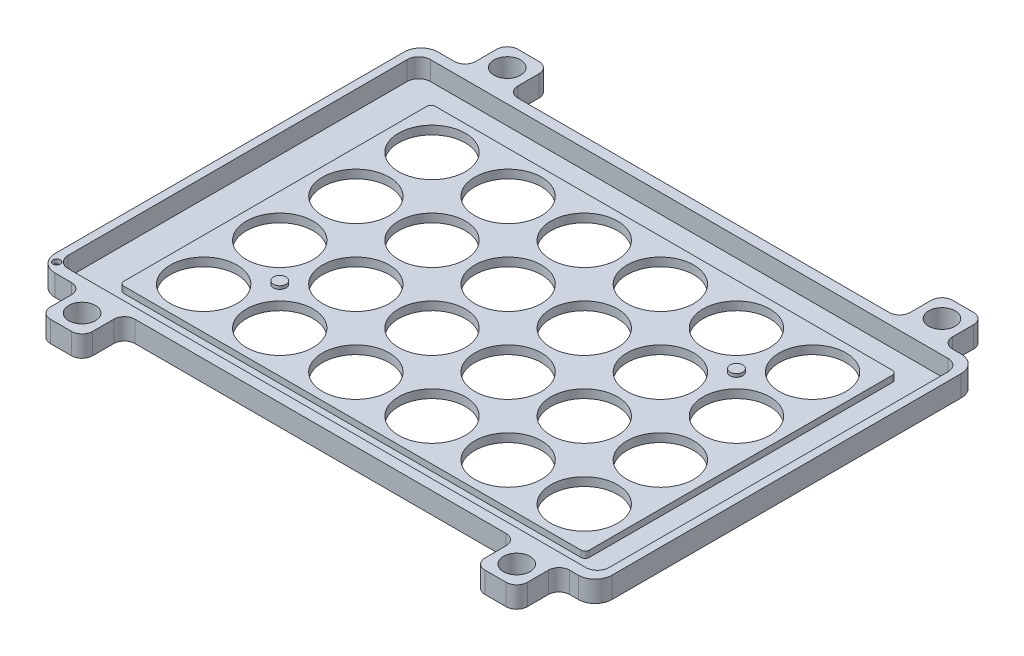
from build123d import *

# Parameters (mm, degrees)
SKETCH1_W           = 157.0786
SKETCH1_H           = 90.551
BOSS_EXTRUDE1_DEPTH = 5
SKETCH7_R           = 7.895
CUT_EXTRUDE5_DEPTH  = 182.378527337
SKETCH23_W          = 127.9
SKETCH23_H          = 85.66
SKETCH23_W_2        = 110.1
SKETCH23_H_2        = 73.66
CUT_EXTRUDE21_DEPTH = 4.5
FILLET7_R           = 1
FILLET8_R           = 2.75
SKETCH26_W          = 115.5003573
SKETCH26_H          = 73.66
CUT_EXTRUDE22_DEPTH = 3
SKETCH29_W          = 12.67569
SKETCH29_H          = 90.551
CUT_EXTRUDE25_DEPTH = 182.378527337
FILLET9_R           = 4
SKETCH30_W          = 10
SKETCH30_H          = 10
BOSS_EXTRUDE2_DEPTH = 5
SKETCH31_R          = 3.15
CUT_EXTRUDE26_DEPTH = 177.033246909
FILLET10_R          = 2.5
SKETCH35_R          = 1.5
BOSS_EXTRUDE3_DEPTH = 0.75
SKETCH37_R          = 0.875
CUT_EXTRUDE29_DEPTH = 1


with BuildPart() as part:
    # Sketch1 → Boss-Extrude1 (new body)
    with BuildSketch(Plane(origin=(0, 0, 0), x_dir=(1, 0, 0), z_dir=(0, 1, 0))):
        with Locations((78.5393, -45.2755)):
            Rectangle(SKETCH1_W, SKETCH1_H)
    extrude(amount=BOSS_EXTRUDE1_DEPTH)

    # Sketch7 → Cut-Extrude5 (cut, through all)
    with BuildSketch(Plane.XZ):
        with Locations((33.5393, 72.2755)):
            Circle(SKETCH7_R)
        with Locations((51.5393, 72.2755)):
            Circle(SKETCH7_R)
        with Locations((69.5393, 72.2755)):
            Circle(SKETCH7_R)
        with Locations((87.5393, 72.2755)):
            Circle(SKETCH7_R)
        with Locations((105.5393, 72.2755)):
            Circle(SKETCH7_R)
        with Locations((123.5393, 72.2755)):
            Circle(SKETCH7_R)
        with Locations((51.5393, 54.2755)):
            Circle(SKETCH7_R)
        with Locations((69.5393, 54.2755)):
            Circle(SKETCH7_R)
        with Locations((87.5393, 54.2755)):
            Circle(SKETCH7_R)
        with Locations((105.5393, 54.2755)):
            Circle(SKETCH7_R)
        with Locations((123.5393, 54.2755)):
            Circle(SKETCH7_R)
        with Locations((51.5393, 36.2755)):
            Circle(SKETCH7_R)
        with Locations((69.5393, 36.2755)):
            Circle(SKETCH7_R)
        with Locations((87.5393, 36.2755)):
            Circle(SKETCH7_R)
        with Locations((105.5393, 36.2755)):
            Circle(SKETCH7_R)
        with Locations((123.5393, 36.2755)):
            Circle(SKETCH7_R)
        with Locations((51.5393, 18.2755)):
            Circle(SKETCH7_R)
        with Locations((69.5393, 18.2755)):
            Circle(SKETCH7_R)
        with Locations((87.5393, 18.2755)):
            Circle(SKETCH7_R)
        with Locations((105.5393, 18.2755)):
            Circle(SKETCH7_R)
        with Locations((123.5393, 18.2755)):
            Circle(SKETCH7_R)
        with Locations((33.5393, 54.2755)):
            Circle(SKETCH7_R)
        with Locations((33.5393, 36.2755)):
            Circle(SKETCH7_R)
        with Locations((33.5393, 18.2755)):
            Circle(SKETCH7_R)
    extrude(amount=-CUT_EXTRUDE5_DEPTH, mode=Mode.SUBTRACT)

    # Sketch23 → Cut-Extrude21 (cut)
    with BuildSketch(Plane(origin=(0, 5, 0), x_dir=(1, 0, 0), z_dir=(0, 1, 0))):
        with Locations((78.5393, -45.2755)):
            Rectangle(SKETCH23_W, SKETCH23_H)
        with Locations((78.5393, -45.2755)):
            Rectangle(SKETCH23_W_2, SKETCH23_H_2, mode=Mode.SUBTRACT)
    extrude(amount=-CUT_EXTRUDE21_DEPTH, mode=Mode.SUBTRACT)

    # Fillet7
    fillet7_edges = [part.edges().sort_by_distance(p)[0] for p in [
        (133.5893, 2.75, 8.4455),
        (23.4893, 2.75, 8.4455),
        (23.4893, 2.75, 82.1055),
        (133.5893, 2.75, 82.1055),
    ]]
    fillet(fillet7_edges, radius=FILLET7_R)

    # Fillet8
    fillet8_edges = [part.edges().sort_by_distance(p)[0] for p in [
        (142.4893, 2.75, 2.4455),
        (14.5893, 2.75, 2.4455),
        (14.5893, 2.75, 88.1055),
        (142.4893, 2.75, 88.1055),
    ]]
    fillet(fillet8_edges, radius=FILLET8_R)

    # Sketch26 → Cut-Extrude22 (cut)
    with BuildSketch(Plane(origin=(0, 5, 0), x_dir=(1, 0, 0), z_dir=(0, 1, 0))):
        with Locations((75.83912135, -45.2755)):
            Rectangle(SKETCH26_W, SKETCH26_H)
    extrude(amount=-CUT_EXTRUDE22_DEPTH, mode=Mode.SUBTRACT)

    # Sketch29 → Cut-Extrude25 (cut, through all)
    with BuildSketch(Plane(origin=(0, 5, 0), x_dir=(1, 0, 0), z_dir=(0, 1, 0))):
        with Locations((150.740755, -45.2755)):
            Rectangle(SKETCH29_W, SKETCH29_H)
        with Locations((6.337845, -45.2755)):
            Rectangle(SKETCH29_W, SKETCH29_H)
    extrude(amount=-CUT_EXTRUDE25_DEPTH, mode=Mode.SUBTRACT)

    # Fillet9
    fillet9_edges = [part.edges().sort_by_distance(p)[0] for p in [
        (12.67569, 2.5, 90.551),
        (144.40291, 2.5, 90.551),
        (144.40291, 2.5, 0),
        (12.67569, 2.5, 0),
    ]]
    fillet(fillet9_edges, radius=FILLET9_R)

    # Sketch30 → Boss-Extrude2 (add)
    with BuildSketch(Plane.XZ):
        with Locations((130.8527, -5)):
            Rectangle(SKETCH30_W, SKETCH30_H)
        with Locations((28.0666303, -5)):
            Rectangle(SKETCH30_W, SKETCH30_H)
        with Locations((130.8527, 95.551)):
            Rectangle(SKETCH30_W, SKETCH30_H)
        with Locations((28.0666303, 95.551)):
            Rectangle(SKETCH30_W, SKETCH30_H)
    extrude(amount=-BOSS_EXTRUDE2_DEPTH)

    # Sketch31 → Cut-Extrude26 (cut, through all)
    with BuildSketch(Plane(origin=(0, 5, 0), x_dir=(1, 0, 0), z_dir=(0, 1, 0))):
        with Locations((28.0666303, 5)):
            Circle(SKETCH31_R)
        with Locations((130.8527, 5)):
            Circle(SKETCH31_R)
        with Locations((28.0666303, -95.551)):
            Circle(SKETCH31_R)
        with Locations((130.8527, -95.551)):
            Circle(SKETCH31_R)
    extrude(amount=-CUT_EXTRUDE26_DEPTH, mode=Mode.SUBTRACT)

    # Fillet10
    fillet10_edges = [part.edges().sort_by_distance(p)[0] for p in [
        (23.0666303, 2.5, 100.551),
        (125.8527, 2.5, 100.551),
        (33.0666303, 2.5, 100.551),
        (135.8527, 2.5, 100.551),
        (135.8527, 2.5, -10),
        (125.8527, 2.5, -10),
        (33.0666303, 2.5, -10),
        (23.0666303, 2.5, -10),
        (23.0666303, 2.5, 90.551),
        (33.0666303, 2.5, 90.551),
        (125.8527, 2.5, 90.551),
        (135.8527, 2.5, 90.551),
        (135.8527, 2.5, 0),
        (125.8527, 2.5, 0),
        (33.0666303, 2.5, 0),
        (23.0666303, 2.5, 0),
    ]]
    fillet(fillet10_edges, radius=FILLET10_R)

    # Sketch35 → Boss-Extrude3 (add)
    with BuildSketch(Plane(origin=(0, 2, 0), x_dir=(1, 0, 0), z_dir=(0, 1, 0))):
        with Locations((114.5393, -27.2755)):
            Circle(SKETCH35_R)
        with Locations((42.5393, -63.2755)):
            Circle(SKETCH35_R)
    extrude(amount=BOSS_EXTRUDE3_DEPTH)

    # Sketch37 → Cut-Extrude29 (cut)
    with BuildSketch(Plane(origin=(0, 5, 0), x_dir=(1, 0, 0), z_dir=(0, 1, 0))):
        with Locations((14.5893, -88.1055)):
            Circle(SKETCH37_R)
    extrude(amount=-CUT_EXTRUDE29_DEPTH, mode=Mode.SUBTRACT)


solid = part.part
